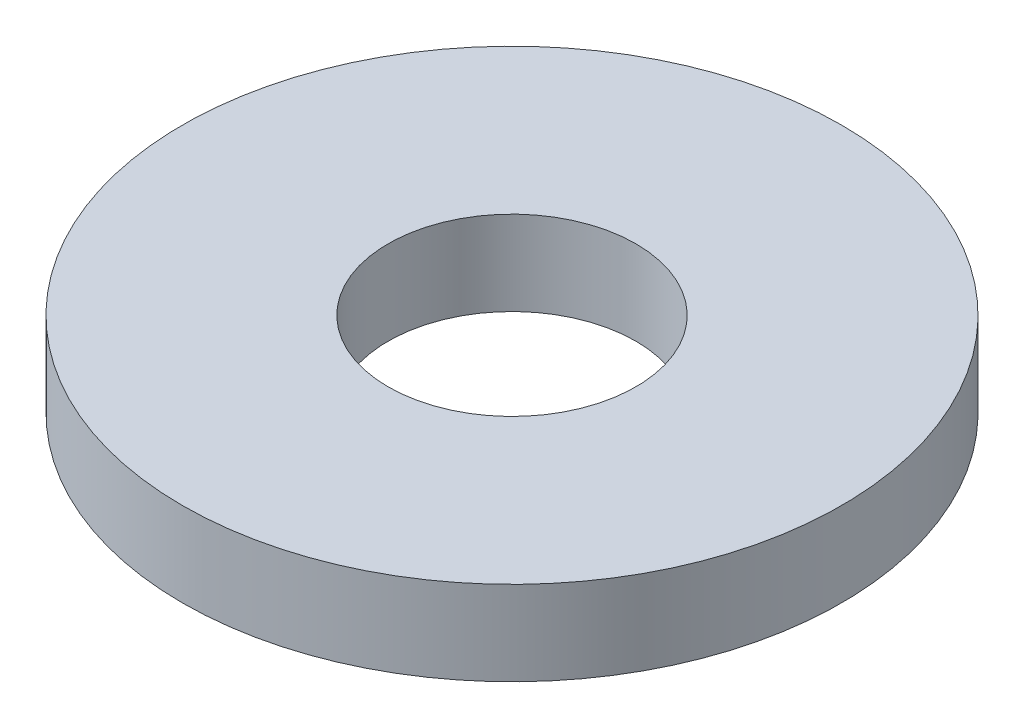
from build123d import *

# Parameters (mm, degrees)
SKETCH1_R           = 3.175
BOSS_EXTRUDE1_DEPTH = 0.8128
SKETCH5_R           = 1.1938
CUT_EXTRUDE1_DEPTH  = 5.56310134


with BuildPart() as part:
    # Sketch1 → Boss-Extrude1 (new body)
    with BuildSketch(Plane(origin=(0, 0, 0), x_dir=(1, 0, 0), z_dir=(0, 1, 0))):
        Circle(SKETCH1_R)
    extrude(amount=BOSS_EXTRUDE1_DEPTH)

    # Sketch5 → Cut-Extrude1 (cut, through all)
    with BuildSketch(Plane(origin=(0, 0.8128, 0), x_dir=(-1, 0, 0), z_dir=(0, 1, 0))):
        Circle(SKETCH5_R)
    extrude(amount=-CUT_EXTRUDE1_DEPTH, mode=Mode.SUBTRACT)


solid = part.part
